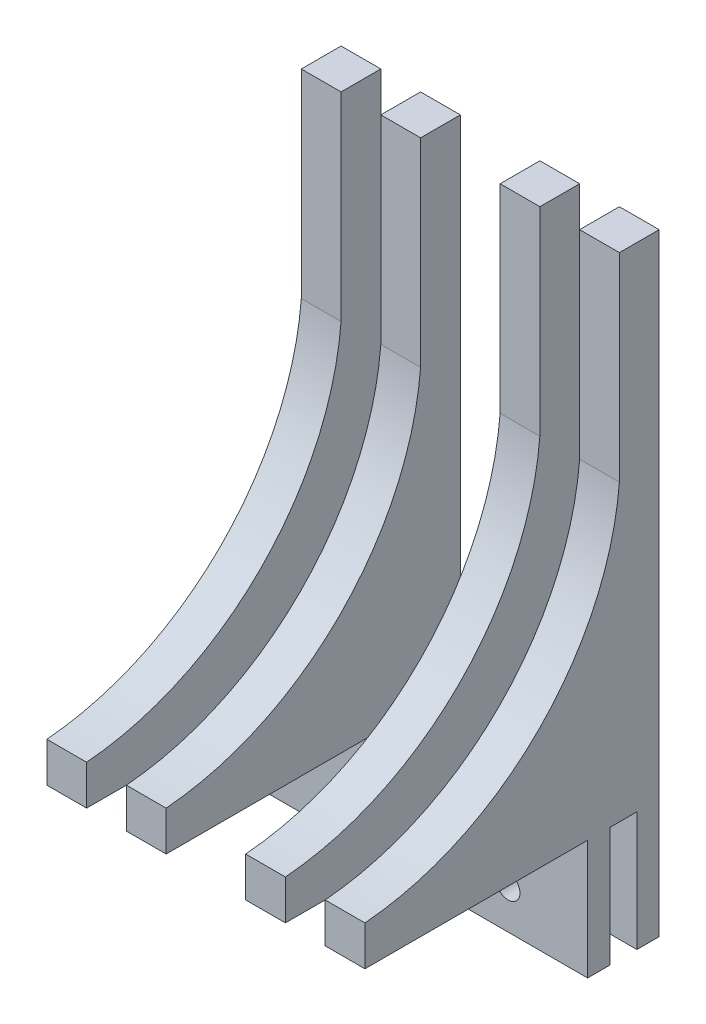
from build123d import *

# Parameters (mm, degrees)
SKETCH1_W            = 9
SKETCH1_H            = 23
BOSS_EXTRUDE1_DEPTH  = 40
BOSS_EXTRUDE2_DEPTH  = 5
LPATTERN1_COUNT      = 2
LPATTERN1_PITCH      = 10
SKETCH6_W            = 40
SKETCH6_H            = 2.8
BOSS_EXTRUDE4_DEPTH  = 15
SKETCH7_W            = 5
SKETCH7_H            = 23
CUT_EXTRUDE1_DEPTH   = 83.540898953
SKETCH8_R            = 1.5
CUT_EXTRUDE2_DEPTH   = 79.917678628
MIRROR1_COPY_1_DEPTH = 5


with BuildPart() as part:
    # Sketch1 → Boss-Extrude1 (new body)
    with BuildSketch(Plane(origin=(0, 0, 0), x_dir=(0, 0, -1), z_dir=(1, 0, 0))):
        with Locations((4.5, 11.5)):
            Rectangle(SKETCH1_W, SKETCH1_H)
    extrude(amount=BOSS_EXTRUDE1_DEPTH)

    # Sketch3 → Boss-Extrude2 (add)
    with BuildSketch(Plane.ZY):
        with BuildLine():
            Line((0, 0), (28, 0))
            Line((28, 0), (28, 5))
            ThreePointArc((28, 5), (6.132470247, 15.132470247), (-4, 37))
            Line((-4, 37), (-4, 62))
            Line((-4, 62), (-9, 62))
            Line((-9, 62), (-9, 37))
            Line((-9, 37), (-9, 23))
            Line((-9, 23), (0, 23))
            Line((0, 23), (0, 0))
        make_face()
    boss_extrude2 = extrude(amount=-BOSS_EXTRUDE2_DEPTH)

    # LPattern1: Boss-Extrude2 ×2
    with Locations(*[(i * LPATTERN1_PITCH, 0, 0) for i in range(1, LPATTERN1_COUNT)]):
        add(boss_extrude2)

    # Sketch6 → Boss-Extrude4 (add)
    with BuildSketch(Plane.XZ):
        with Locations((20, -7.6)):
            Rectangle(SKETCH6_W, SKETCH6_H)
        with Locations((20, -1.4)):
            Rectangle(SKETCH6_W, SKETCH6_H)
    extrude(amount=BOSS_EXTRUDE4_DEPTH)

    # Sketch7 → Cut-Extrude1 (cut, through all)
    with BuildSketch(Plane.XY.offset(28)):
        with Locations((7.5, 11.5)):
            Rectangle(SKETCH7_W, SKETCH7_H)
        with Locations((17.5, 11.5)):
            Rectangle(SKETCH7_W, SKETCH7_H)
    cut_extrude1 = extrude(amount=-CUT_EXTRUDE1_DEPTH, mode=Mode.SUBTRACT)

    # Sketch8 → Cut-Extrude2 (cut, through all)
    with BuildSketch(Plane.XY):
        with Locations((10, -10)):
            Circle(SKETCH8_R)
        with Locations((20, -10)):
            Circle(SKETCH8_R)
        with Locations((30, -10)):
            Circle(SKETCH8_R)
    extrude(amount=-CUT_EXTRUDE2_DEPTH, mode=Mode.SUBTRACT)

    # Mirror1: Boss-Extrude2, Cut-Extrude1 across plane
    add(boss_extrude2.mirror(Plane.ZY.offset(-20)))
    add(cut_extrude1.mirror(Plane.ZY.offset(-20)), mode=Mode.SUBTRACT)

    # Mirror1 copy 1 sketch → Mirror1 copy 1 (add)
    with BuildSketch(Plane(origin=(30, 0, 0), x_dir=(0, 0, 1), z_dir=(1, 0, 0))):
        with BuildLine():
            Line((0, 0), (28, 0))
            Line((28, 0), (28, -5))
            ThreePointArc((28, -5), (6.132470247, -15.132470247), (-4, -37))
            Line((-4, -37), (-4, -62))
            Line((-4, -62), (-9, -62))
            Line((-9, -62), (-9, -37))
            Line((-9, -37), (-9, -23))
            Line((-9, -23), (0, -23))
            Line((0, -23), (0, 0))
        make_face()
    extrude(amount=-MIRROR1_COPY_1_DEPTH)


solid = part.part
